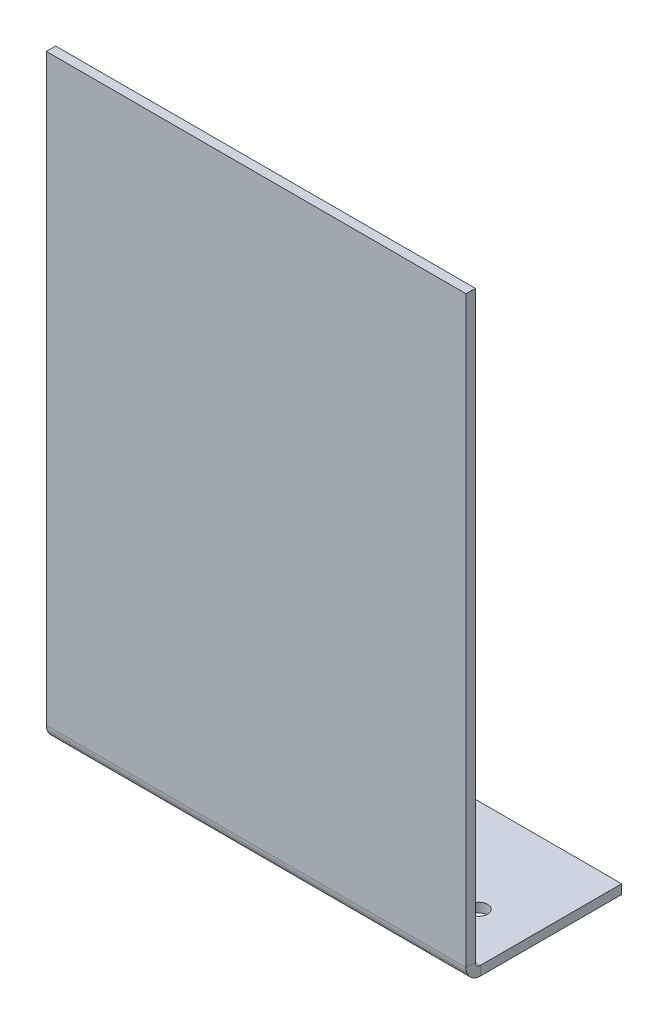
from build123d import *

# Parameters (mm, degrees)
SKETCH1_W              = 71.89414
SKETCH1_H              = 126.6
SKETCH1_R              = 1.4732
BASE_FLANGE1_DEPTH     = 1.6002
SKETCHED_BEND1_DEPTH   = 71.89414
SKETCHED_BEND1_2_DEPTH = 71.89414


# Read off the part's stored shape, not the designer's step: Sketched Bend1
# Sheet-metal steps are written as plain solids
with BuildPart() as part:
    # Sketch1 → Base-Flange1 (new body)
    with BuildSketch(Plane(origin=(0, 0, 0), x_dir=(1, 0, 0), z_dir=(0, 1, 0))):
        with Locations((35.94707, -63.3)):
            Rectangle(SKETCH1_W, SKETCH1_H)
        with Locations(Location((8.44707, -16.01, 0), (0, 0, 270))):
            Circle(SKETCH1_R, mode=Mode.SUBTRACT)
        with Locations(Location((63.44707, -16.01, 0), (0, 0, 270))):
            Circle(SKETCH1_R, mode=Mode.SUBTRACT)
    extrude(amount=-BASE_FLANGE1_DEPTH)

    # Sketched Bend1 outline → Sketched Bend1 (cut)
    with BuildSketch(Plane.YZ):
        with BuildLine():
            ThreePointArc((-1.6002, 24.173927493), (-1.16148963, 25.585171243), (0, 26.49896419))
            Line((0, 26.49896419), (0, 126.6))
            Line((0, 126.6), (-1.6002, 126.6))
            Line((-1.6002, 126.6), (-1.6002, 24.173927493))
        make_face()
    extrude(amount=SKETCHED_BEND1_DEPTH, mode=Mode.SUBTRACT)

    # Sketched Bend1 2 outline → Sketched Bend1 2 (add)
    with BuildSketch(Plane.YZ):
        with BuildLine():
            ThreePointArc((0, 24.173927493), (0.260382071, 24.802545421), (0.889, 25.062927493))
            Line((0.889, 25.062927493), (100.862927493, 25.062927493))
            Line((100.862927493, 25.062927493), (100.862927493, 26.663127493))
            Line((100.862927493, 26.663127493), (0.889, 26.663127493))
            ThreePointArc((0.889, 26.663127493), (0.436984903, 26.62174264), (0, 26.49896419))
            Line((0, 26.49896419), (0, 24.173927493))
        make_face()
    extrude(amount=SKETCHED_BEND1_2_DEPTH)


solid = part.part
